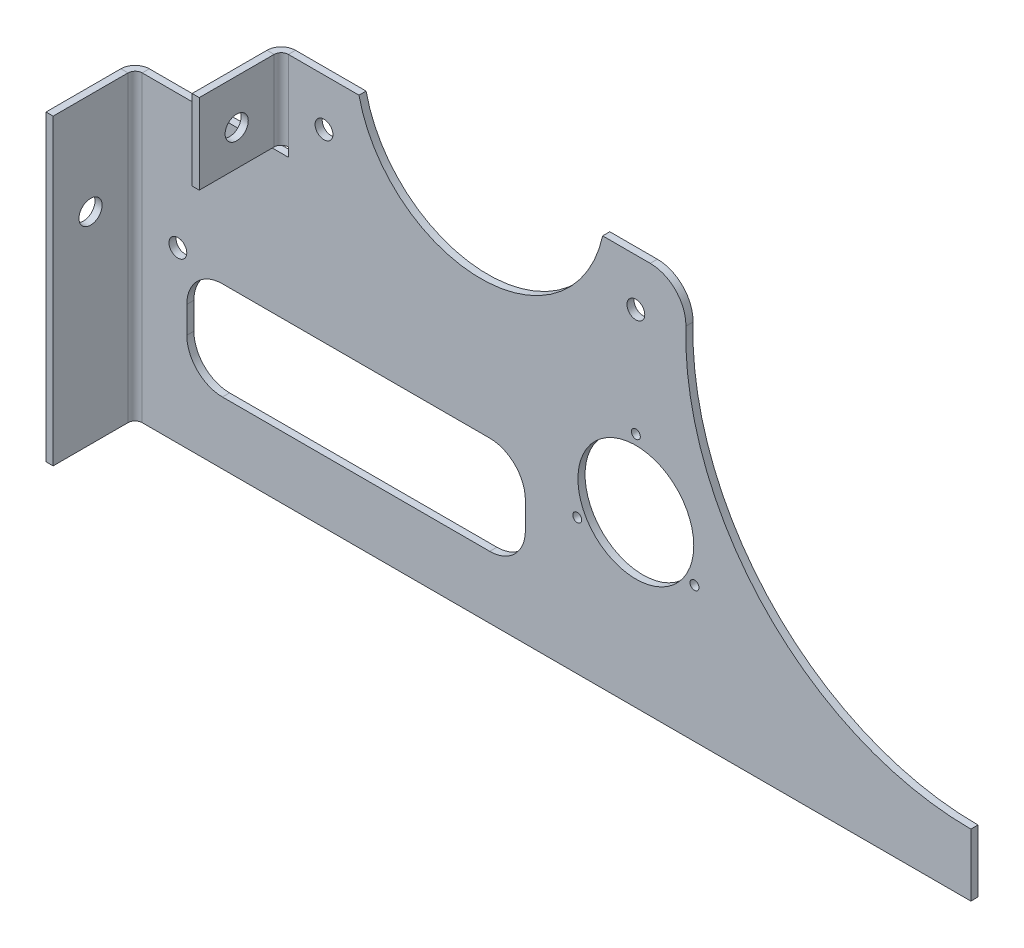
from build123d import *

# Parameters (mm, degrees)
SKETCH_1_W                  = 190
SKETCH_1_H                  = 55
SM_BASE_FLANGE_1_DEPTH      = 4
SKETCH_6_R                  = 32.5
SKETCH_6_R_2                = 2.5
CUT_EXTRUDE_1_DEPTH         = 10
SKETCH_7_R                  = 5
CUT_EXTRUDE_2_DEPTH         = 10
FILLET_1_R                  = 20
FILLET_2_R                  = 20
SM_EDGE_FLANGE_1_DEPTH      = 45
SM_EDGE_FLANGE_1_BEND_DEPTH = 170
CUT_EXTRUDE_4_REACH         = 525.684
SKETCH_15_R                 = 6.5


# Sheet-metal steps are written as plain solids
with BuildPart() as part:
    # Sketch 1 → 基体-法兰1 (new body)
    with BuildSketch(Plane.XY):
        with BuildLine():
            Line((0, 0), (0, 170))
            Line((0, 170), (82, 170))
            Line((82, 170), (82, 220))
            Line((82, 220), (121.626028344, 220))
            ThreePointArc((121.626028344, 220), (190, 165), (258.373971656, 220))
            Line((258.373971656, 220), (306.965193707, 220))
            ThreePointArc((306.965193707, 220), (343.344749394, 91.076951546), (465, 35))
            Line((465, 35), (465, 0))
            Line((465, 0), (0, 0))
        make_face()
        with Locations((120, 62.5)):
            Rectangle(SKETCH_1_W, SKETCH_1_H, mode=Mode.SUBTRACT)
    extrude(amount=-SM_BASE_FLANGE_1_DEPTH)

    # 草图6 → 切除-拉伸1 (cut)
    with BuildSketch(Plane.XY):
        with Locations((277, 95)):
            Circle(SKETCH_6_R)
        with Locations((277, 133)):
            Circle(SKETCH_6_R_2)
        with Locations((309.908965344, 76)):
            Circle(SKETCH_6_R_2)
        with Locations((244.091034656, 76)):
            Circle(SKETCH_6_R_2)
    extrude(amount=-CUT_EXTRUDE_1_DEPTH, mode=Mode.SUBTRACT)

    # 草图7 → 切除-拉伸2 (cut)
    with BuildSketch(Plane.XY):
        with Locations((20, 95)):
            Circle(SKETCH_7_R)
        with Locations((102, 193.5)):
            Circle(SKETCH_7_R)
        with Locations((277, 193.5)):
            Circle(SKETCH_7_R)
    extrude(amount=-CUT_EXTRUDE_2_DEPTH, mode=Mode.SUBTRACT)

    # 圆角1
    fillet_1_edges = [part.edges().sort_by_distance(p)[0] for p in [
        (25, 35, -2),
        (25, 90, -2),
        (215, 90, -2),
        (215, 35, -2),
    ]]
    fillet(fillet_1_edges, radius=FILLET_1_R)

    # 圆角2
    fillet_2_edges = [part.edges().sort_by_distance(p)[0] for p in [
        (306.965193707, 220, -2),
    ]]
    fillet(fillet_2_edges, radius=FILLET_2_R)

    # 边线-法兰1 section (across the edge) → 边线-法兰1 (add)
    with BuildSketch(Plane(origin=(78, 220, 0), x_dir=(1, 0, 0), z_dir=(0, -1, 0))):
        with BuildLine():
            Line((-4, 4), (-4, 46))
            Line((-4, 46), (0, 46))
            Line((0, 46), (0, 4))
            ThreePointArc((0, 4), (1.171572875, 1.171572875), (4, 0))
            Line((4, 0), (4, -4))
            ThreePointArc((4, -4), (-1.656854249, -1.656854249), (-4, 4))
        make_face()
    extrude(amount=SM_EDGE_FLANGE_1_DEPTH)

    # 边线-法兰1 section 2 (across the edge) → 边线-法兰1 bend (add)
    with BuildSketch(Plane(origin=(-4, 170, 0), x_dir=(1, 0, 0), z_dir=(0, -1, 0))):
        with BuildLine():
            Line((-4, 4), (-4, 46))
            Line((-4, 46), (0, 46))
            Line((0, 46), (0, 4))
            ThreePointArc((0, 4), (1.171572875, 1.171572875), (4, 0))
            Line((4, 0), (4, -4))
            ThreePointArc((4, -4), (-1.656854249, -1.656854249), (-4, 4))
        make_face()
    extrude(amount=SM_EDGE_FLANGE_1_BEND_DEPTH)

    # 草图15 → 切除-拉伸4 (cut, up to next)
    with BuildSketch(Plane.ZY.offset(8), mode=Mode.PRIVATE) as cut_extrude_4_sk1:
        with Locations((25, 113)):
            Circle(SKETCH_15_R)
    cut_extrude_4_tool1 = extrude(cut_extrude_4_sk1.sketch, amount=-CUT_EXTRUDE_4_REACH, mode=Mode.PRIVATE) & part.part
    # 草图15 → 切除-拉伸4 (cut, up to next)
    with BuildSketch(Plane.ZY.offset(8), mode=Mode.PRIVATE) as cut_extrude_4_sk2:
        with Locations(Location((25, 195, 0), (0, 0, 180))):
            Circle(SKETCH_15_R)
    cut_extrude_4_tool2 = extrude(cut_extrude_4_sk2.sketch, amount=-CUT_EXTRUDE_4_REACH, mode=Mode.PRIVATE) & part.part
    add(cut_extrude_4_tool1.solids().sort_by_distance((-8, 113, 25))[0], mode=Mode.SUBTRACT)
    add(cut_extrude_4_tool2.solids().sort_by_distance((-8, 195, 25))[0], mode=Mode.SUBTRACT)


solid = part.part
